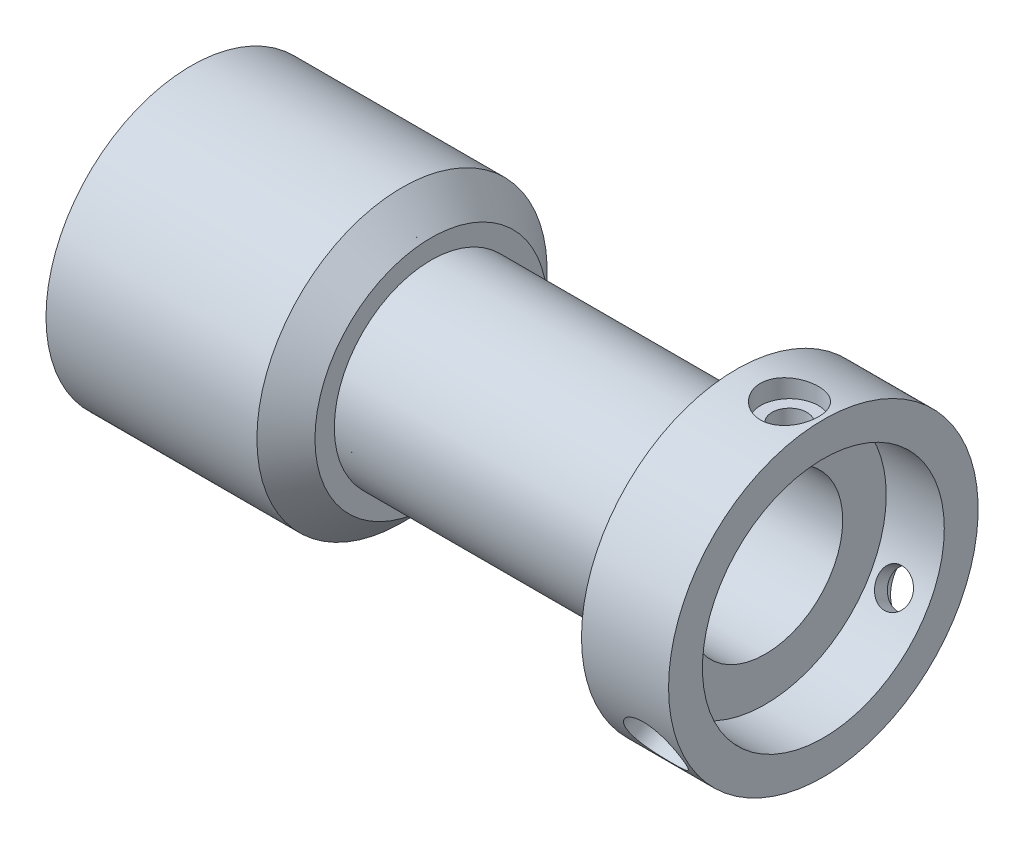
from build123d import *

# Parameters (mm, degrees)
SKETCH_2_R               = 8
CUT_EXTRUDE_1_DEPTH      = 70.156507286
SKETCH_5_R               = 12.5
CUT_EXTRUDE_2_DEPTH      = 6
CHAMFER_1_SIZE           = 3
PATTERN_CIRCULAR_3_COUNT = 8
PATTERN_CIRCULAR_4_COUNT = 3


# Read off the part's stored shape, not the designer's step: 打孔尺寸(%根据)内六角圆柱头螺钉的类型1
with BuildPart() as part:
    # 草图1 → 旋转1 (revolve)
    with BuildSketch(Plane(origin=(0, 0, 0), x_dir=(1, 0, 0), z_dir=(0, 1, 0)), mode=Mode.PRIVATE) as revolve_1_sk:
        Polygon((0, 0), (0, 15), (24.8, 15), (24.8, 10), (56.35, 10), (56.35, 16), (65.35, 16), (65.35, 0), align=None)
    revolve(revolve_1_sk.sketch.rotate(Axis((-27.673469388, 0, 0), (1, 0, 0)), 180), axis=Axis((-27.673469388, 0, 0), (1, 0, 0)))

    # 草图2 → 切除-拉伸1 (cut, through all)
    with BuildSketch(Plane.ZY):
        Circle(SKETCH_2_R)
    extrude(amount=-CUT_EXTRUDE_1_DEPTH, mode=Mode.SUBTRACT)

    # 草图5 → 切除-拉伸2 (cut)
    with BuildSketch(Plane(origin=(65.35, 0, 0), x_dir=(0, 0, -1), z_dir=(1, 0, 0))):
        Circle(SKETCH_5_R)
    extrude(amount=-CUT_EXTRUDE_2_DEPTH, mode=Mode.SUBTRACT)

    # 倒角1
    chamfer_1_edges = [part.edges().sort_by_distance(p)[0] for p in [
        (24.8, 0, -15),
    ]]
    chamfer(chamfer_1_edges, length=CHAMFER_1_SIZE)

    # 草图11 → M4 螺纹孔1 (revolve, cut)
    with BuildSketch(Plane.ZX.offset(11.25)):
        Polygon((0, 0), (0, 8.091420021), (1.65, 7.1), (1.65, 0), align=None)
    hole_wizard_m4_1 = revolve(axis=Axis((-6.35, 11.25, 0), (1, 0, 0)), mode=Mode.SUBTRACT)

    # 阵列(圆周)3: M4 螺纹孔1 ×8 about axis
    pattern_circular_3_axis = Axis((0, 0, 0), (1, 0, 0))
    for i in range(1, PATTERN_CIRCULAR_3_COUNT):
        add(hole_wizard_m4_1.rotate(pattern_circular_3_axis, i * 360 / PATTERN_CIRCULAR_3_COUNT), mode=Mode.SUBTRACT)

    # 打孔尺寸(%根据)内六角圆柱头螺钉的类型1 outline → 打孔尺寸(%根据)内六角圆柱头螺钉的类型1 (revolve, cut)
    with BuildSketch(Plane(origin=(61.85, 0, 0), x_dir=(1, 0, 0), z_dir=(0, 0, 1))):
        Polygon((1.8, 14), (3, 14), (3, 16.000041716), (0, 16.000041716), (0, 12.369650157), (1.8, 12.369650157), align=None)
    hole_wizard_1 = revolve(axis=Axis((61.85, 0, 0), (0, 1, 0)), mode=Mode.SUBTRACT)

    # 阵列(圆周)4: 打孔尺寸(%根据)内六角圆柱头螺钉的类型1 ×3 about axis
    pattern_circular_4_axis = Axis((0, 0, 0), (1, 0, 0))
    for i in range(1, PATTERN_CIRCULAR_4_COUNT):
        add(hole_wizard_1.rotate(pattern_circular_4_axis, i * 360 / PATTERN_CIRCULAR_4_COUNT), mode=Mode.SUBTRACT)


solid = part.part
